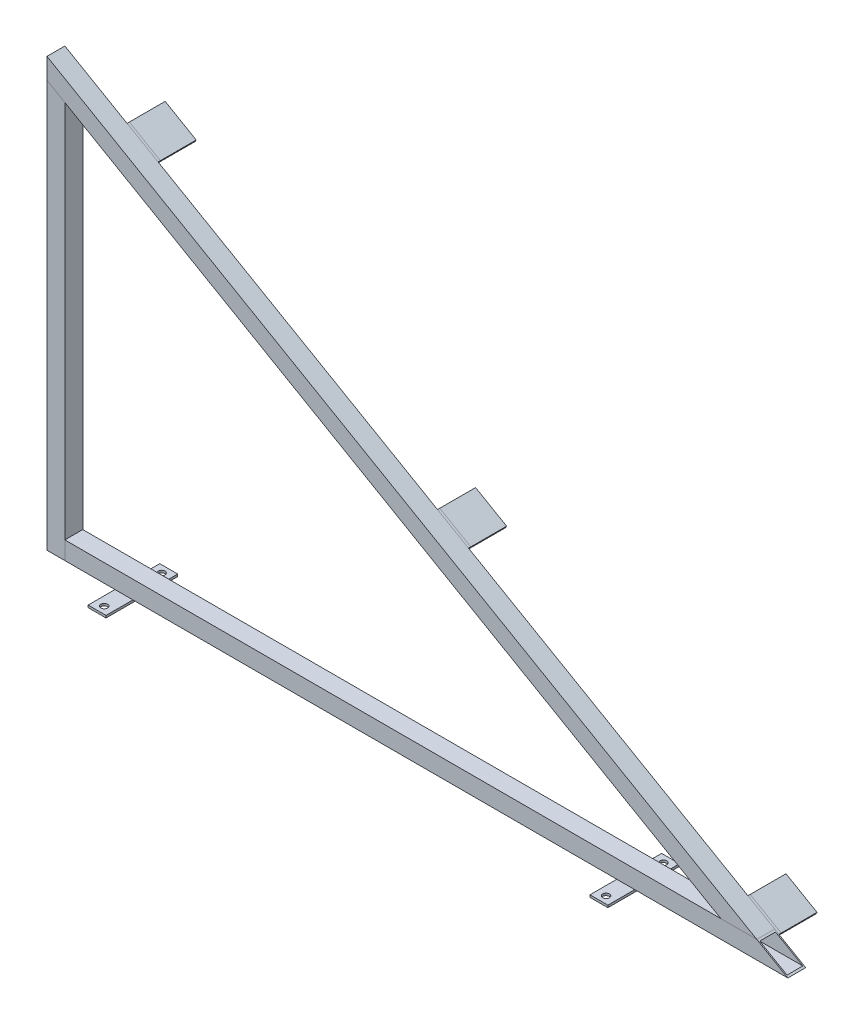
from build123d import *

# Parameters (mm, degrees)
RECTANGULAR_START                    = -12.7
RECTANGULAR_TUBE_1X1X0_060_1_DEPTH   = 25.4
RECTANGULAR_TUBE_1X1X0_060_1_2_DEPTH = 1.524
RECTANGULAR_START_2                  = 11.176
RECTANGULAR_TUBE_1X1X0_060_1_3_DEPTH = 1.524
RECTANGULAR_TUBE_1X1X0_060_1_4_DEPTH = 25.4
RECTANGULAR_TUBE_1X1X0_060_1_5_DEPTH = 1.524
RECTANGULAR_TUBE_1X1X0_060_1_6_DEPTH = 1.524
RECTANGULAR_TUBE_1X1X0_060_1_7_DEPTH = 25.4
RECTANGULAR_TUBE_1X1X0_060_1_8_DEPTH = 1.524
RECTANGULAR_TUBE_1X1X0_060_1_9_DEPTH = 1.524
SKETCH3_W                            = 25.4
SKETCH3_H                            = 101.6
SKETCH3_R                            = 4.7625
BOSS_EXTRUDE1_DEPTH                  = 3.175
LPATTERN1_COUNT                      = 2
LPATTERN1_PITCH                      = 711.2
BOSS_EXTRUDE2_DEPTH                  = 3.175
BOSS_EXTRUDE3_DEPTH                  = 50.8
LPATTERN2_START                      = 810.015529895
LPATTERN2_OUTLINE_W                  = 3.175
LPATTERN2_OUTLINE_H                  = 50.8
LPATTERN2_DEPTH                      = 50.8
LPATTERN2_START_2                    = 302.015529895
LPATTERN2_2_OUTLINE_W                = 3.175
LPATTERN2_2_OUTLINE_H                = 50.8
LPATTERN2_2_DEPTH                    = 50.8
LPATTERN2_3_OUTLINE_W                = 50.8
LPATTERN2_3_OUTLINE_H                = 3.175
LPATTERN2_3_DEPTH                    = 50.8
LPATTERN2_4_OUTLINE_W                = 50.8
LPATTERN2_4_OUTLINE_H                = 3.175
LPATTERN2_4_DEPTH                    = 50.8


# Read off the part's stored shape, not the designer's step: Rectangular tube 1X1X0_060(1), LPattern2
with BuildPart() as part:
    # Rectangular tube 1X1X0_060(1) outline → Rectangular tube 1X1X0_060(1) (new body)
    with BuildSketch(Plane.XY.offset(RECTANGULAR_START)):
        Polygon((942.469991269, 12.7), (945.517991269, 12.7), (-12.7, 565.927415202), (-12.7, 564.167651581), align=None)
        Polygon((-12.7, 591.737281636), (990.221991269, 12.7), (993.269991269, 12.7), (-12.7, 593.497045256), align=None)
    extrude(amount=RECTANGULAR_TUBE_1X1X0_060_1_DEPTH)

    # Rectangular tube 1X1X0_060_1 2 outline → Rectangular tube 1X1X0_060_1 2 (add)
    with BuildSketch(Plane.XY.offset(RECTANGULAR_START)):
        Polygon((-12.7, 565.927415202), (945.517991269, 12.7), (990.221991269, 12.7), (-12.7, 591.737281636), align=None)
    extrude(amount=RECTANGULAR_TUBE_1X1X0_060_1_2_DEPTH)

    # Rectangular tube 1X1X0_060_1 3 outline → Rectangular tube 1X1X0_060_1 3 (add)
    with BuildSketch(Plane.XY.offset(RECTANGULAR_START_2)):
        Polygon((-12.7, 565.927415202), (945.517991269, 12.7), (990.221991269, 12.7), (-12.7, 591.737281636), align=None)
    extrude(amount=RECTANGULAR_TUBE_1X1X0_060_1_3_DEPTH)


with BuildPart() as body_2:
    # Rectangular tube 1X1X0_060_1 4 outline → Rectangular tube 1X1X0_060_1 4 (new body)
    with BuildSketch(Plane.XY.offset(RECTANGULAR_START)):
        Polygon((12.7, 549.502954744), (11.176, 550.382836554), (11.176, -12.7), (12.7, -12.7), align=None)
        Polygon((-11.176, -12.7), (-11.176, 563.287769771), (-12.7, 564.167651581), (-12.7, -12.7), align=None)
    extrude(amount=RECTANGULAR_TUBE_1X1X0_060_1_4_DEPTH)

    # Rectangular tube 1X1X0_060_1 5 outline → Rectangular tube 1X1X0_060_1 5 (add)
    with BuildSketch(Plane.XY.offset(RECTANGULAR_START)):
        Polygon((11.176, -12.7), (11.176, 550.382836554), (-11.176, 563.287769771), (-11.176, -12.7), align=None)
    extrude(amount=RECTANGULAR_TUBE_1X1X0_060_1_5_DEPTH)

    # Rectangular tube 1X1X0_060_1 6 outline → Rectangular tube 1X1X0_060_1 6 (add)
    with BuildSketch(Plane.XY.offset(RECTANGULAR_START_2)):
        Polygon((11.176, -12.7), (11.176, 550.382836554), (-11.176, 563.287769771), (-11.176, -12.7), align=None)
    extrude(amount=RECTANGULAR_TUBE_1X1X0_060_1_6_DEPTH)


with BuildPart() as body_3:
    # Rectangular tube 1X1X0_060_1 7 outline → Rectangular tube 1X1X0_060_1 7 (new body)
    with BuildSketch(Plane.XY.offset(RECTANGULAR_START)):
        Polygon((12.7, 12.7), (12.7, 11.176), (995.9096367, 11.176), (993.269991269, 12.7), align=None)
        Polygon((1034.624436351, -11.176), (12.7, -11.176), (12.7, -12.7), (1037.264081782, -12.7), align=None)
    extrude(amount=RECTANGULAR_TUBE_1X1X0_060_1_7_DEPTH)

    # Rectangular tube 1X1X0_060_1 8 outline → Rectangular tube 1X1X0_060_1 8 (add)
    with BuildSketch(Plane.XY.offset(RECTANGULAR_START)):
        Polygon((995.9096367, 11.176), (12.7, 11.176), (12.7, -11.176), (1034.624436351, -11.176), align=None)
    extrude(amount=RECTANGULAR_TUBE_1X1X0_060_1_8_DEPTH)

    # Rectangular tube 1X1X0_060_1 9 outline → Rectangular tube 1X1X0_060_1 9 (add)
    with BuildSketch(Plane.XY.offset(RECTANGULAR_START_2)):
        Polygon((995.9096367, 11.176), (12.7, 11.176), (12.7, -11.176), (1034.624436351, -11.176), align=None)
    extrude(amount=RECTANGULAR_TUBE_1X1X0_060_1_9_DEPTH)


with BuildPart() as body_4:
    # Sketch3 → Boss-Extrude1 (new body)
    with BuildSketch(Plane.XZ.offset(12.7)):
        with Locations((96.426843049, 0)):
            Rectangle(SKETCH3_W, SKETCH3_H)
        with Locations(Location((96.426843049, 40.64, 0), (0, 0, 270))):
            Circle(SKETCH3_R, mode=Mode.SUBTRACT)
        with Locations(Location((96.426843049, -40.64, 0), (0, 0, 270))):
            Circle(SKETCH3_R, mode=Mode.SUBTRACT)
    boss_extrude1 = extrude(amount=BOSS_EXTRUDE1_DEPTH)


with BuildPart() as lpattern1_1:
    # LPattern1: Boss-Extrude1 ×2
    with Locations(*[(i * LPATTERN1_PITCH, 0, 0) for i in range(1, LPATTERN1_COUNT)]):
        add(boss_extrude1)


with BuildPart() as body_6:
    # Sketch5 → Boss-Extrude2 (new body)
    with BuildSketch(Plane(origin=(0, 0, -12.7), x_dir=(-1, 0, 0), z_dir=(0, 0, -1))):
        Polygon((-75.428975235, 542.615757681), (-119.423065748, 517.215757681), (-94.023065748, 473.221667168), (-50.028975235, 498.621667168), align=None)
    extrude(amount=BOSS_EXTRUDE2_DEPTH)


with BuildPart() as body_7:
    # Sketch6 → Boss-Extrude3 (new body)
    with BuildSketch(Plane(origin=(0, 0, -15.875), x_dir=(-1, 0, 0), z_dir=(0, 0, -1))):
        Polygon((-75.428975235, 542.615757681), (-119.423065748, 517.215757681), (-117.835565748, 514.466127024), (-73.841475235, 539.866127024), align=None)
    extrude(amount=BOSS_EXTRUDE3_DEPTH)


with BuildPart() as body_8:
    # LPattern2 outline → LPattern2 (new body)
    with BuildSketch(Plane(origin=(0, 0, 0), x_dir=(0.500000000000108, 0.8660254037843762, 0), z_dir=(0.8660254037843762, -0.5000000000001082, 0)).offset(LPATTERN2_START)):
        with Locations((506.046018263, -41.275)):
            Rectangle(LPATTERN2_OUTLINE_W, LPATTERN2_OUTLINE_H)
    extrude(amount=LPATTERN2_DEPTH)


with BuildPart() as body_9:
    # LPattern2 2 outline → LPattern2 2 (new body)
    with BuildSketch(Plane(origin=(0, 0, 0), x_dir=(0.500000000000108, 0.8660254037843762, 0), z_dir=(0.8660254037843762, -0.5000000000001082, 0)).offset(LPATTERN2_START_2)):
        with Locations((506.046018263, -41.275)):
            Rectangle(LPATTERN2_2_OUTLINE_W, LPATTERN2_2_OUTLINE_H)
    extrude(amount=LPATTERN2_2_DEPTH)


with BuildPart() as body_10:
    # LPattern2 3 outline → LPattern2 3 (new body)
    with BuildSketch(Plane(origin=(0, 0, 0), x_dir=(0.5000000000000003, 0.8660254037844385, 0), z_dir=(0.8660254037844385, -0.5000000000000003, 0)).offset(LPATTERN2_START)):
        with Locations((482.233518263, -14.2875)):
            Rectangle(LPATTERN2_3_OUTLINE_W, LPATTERN2_3_OUTLINE_H)
    extrude(amount=LPATTERN2_3_DEPTH)


with BuildPart() as body_11:
    # LPattern2 4 outline → LPattern2 4 (new body)
    with BuildSketch(Plane(origin=(0, 0, 0), x_dir=(0.5000000000000003, 0.8660254037844385, 0), z_dir=(0.8660254037844385, -0.5000000000000003, 0)).offset(LPATTERN2_START_2)):
        with Locations((482.233518263, -14.2875)):
            Rectangle(LPATTERN2_4_OUTLINE_W, LPATTERN2_4_OUTLINE_H)
    extrude(amount=LPATTERN2_4_DEPTH)


solid = Compound([part.part, body_2.part, body_3.part, body_4.part, lpattern1_1.part, body_6.part, body_7.part, body_8.part, body_9.part, body_10.part, body_11.part])
